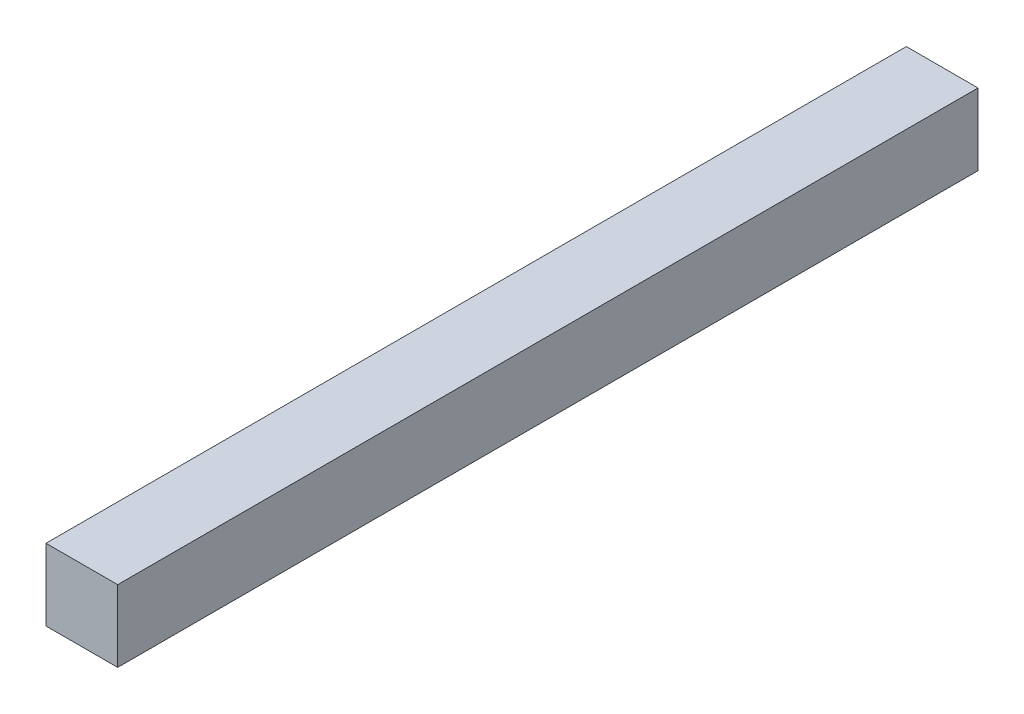
from build123d import *

# Parameters (mm, degrees)
SKETCH1_W           = 38.1
SKETCH1_H           = 38.1
BOSS_EXTRUDE1_DEPTH = 457.2


with BuildPart() as part:
    # Sketch1 → Boss-Extrude1 (new body)
    with BuildSketch(Plane.XY):
        with Locations((10.31875, 12.79921875)):
            Rectangle(SKETCH1_W, SKETCH1_H)
    extrude(amount=BOSS_EXTRUDE1_DEPTH)


solid = part.part
